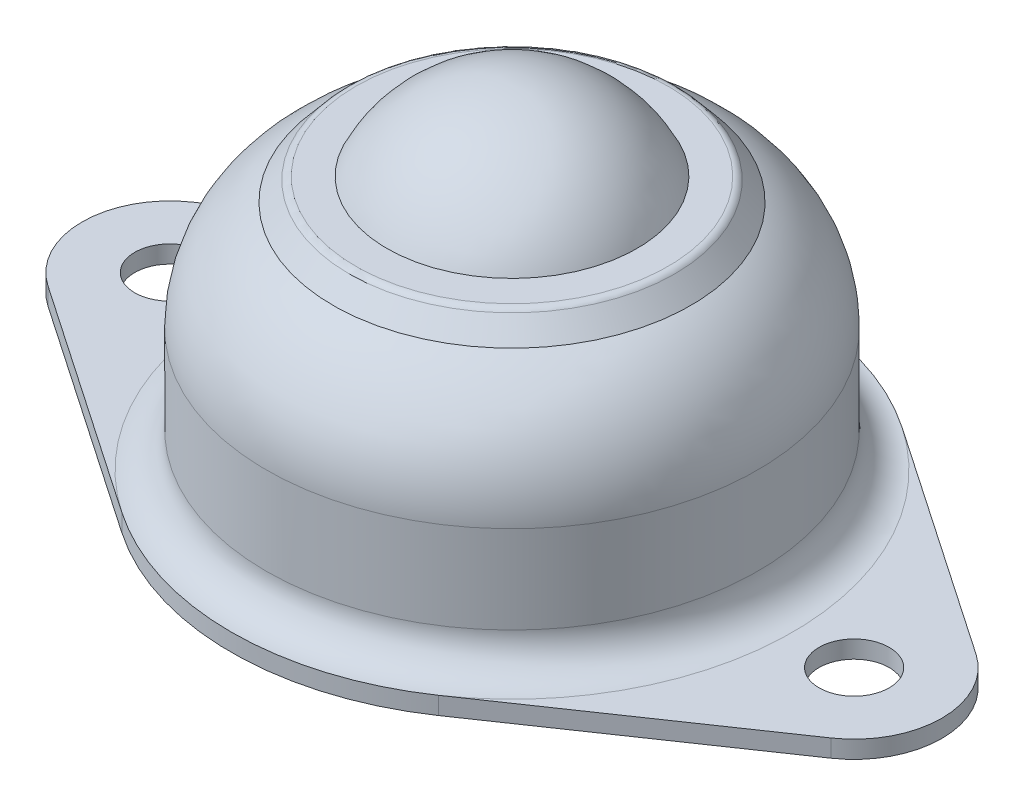
from build123d import *

# Parameters (mm, degrees)
SKETCH_1_R      = 2
EXTRUDE_1_DEPTH = 1
FILLET_1_R      = 2
FILLET_3_R      = 2


with BuildPart() as part:
    # 草圖1 → 填料-伸長1 (new body)
    with BuildSketch(Plane(origin=(0, 0, 0), x_dir=(1, 0, 0), z_dir=(0, 1, 0))):
        with BuildLine():
            Line((-22.320512821, 4.128523638), (-9.025641026, 13.211275642))
            ThreePointArc((-9.025641026, 13.211275642), (0, 16), (9.025641026, 13.211275642))
            Line((9.025641026, 13.211275642), (22.320512821, 4.128523638))
            ThreePointArc((22.320512821, 4.128523638), (24.5, 0), (22.320512821, -4.128523638))
            Line((22.320512821, -4.128523638), (9.025641026, -13.211275642))
            ThreePointArc((9.025641026, -13.211275642), (0, -16), (-9.025641026, -13.211275642))
            Line((-9.025641026, -13.211275642), (-22.320512821, -4.128523638))
            ThreePointArc((-22.320512821, -4.128523638), (-24.5, 0), (-22.320512821, 4.128523638))
        make_face()
        with Locations(Location((19.5, 0, 0), (0, 0, 270))):
            Circle(SKETCH_1_R, mode=Mode.SUBTRACT)
        with Locations(Location((-19.5, 0, 0), (0, 0, 270))):
            Circle(SKETCH_1_R, mode=Mode.SUBTRACT)
    extrude(amount=EXTRUDE_1_DEPTH)

    # 草圖2 → 旋轉1 (revolve)
    with BuildSketch(Plane.XY):
        with BuildLine():
            Line((-14, 1), (-14, 8))
            ThreePointArc((-14, 8), (-12.975019189, 11.646799376), (-10.200244089, 14.2256275))
            Line((-10.200244089, 14.2256275), (-9.280786987, 15.321393805))
            ThreePointArc((-9.280786987, 15.321393805), (-9.109073896, 15.453153894), (-8.897764765, 15.5))
            Line((-8.897764765, 15.5), (-7.130918594, 15.5))
            ThreePointArc((-7.130918594, 15.5), (-4.216040797, 18.780943047), (0, 20))
            Line((0, 20), (0, 1))
            Line((0, 1), (-14, 1))
        make_face()
    revolve(axis=Axis((0, 20, 0), (0, -1, 0)))

    # 圓角1
    fillet_1_edges = [part.edges().sort_by_distance(p)[0] for p in [
        (14, 1, 0),
    ]]
    fillet(fillet_1_edges, radius=FILLET_1_R - 0.0001)  # a hair under: the kernel refuses the full size

    # 草圖3 → 除料-旋轉1 (revolve, cut)
    with BuildSketch(Plane.XY):
        with BuildLine():
            Line((0, 0), (-13, 0))
            Line((-13, 0), (-13, 7))
            Line((-13, 7), (-12.7, 7))
            add(Edge.make_bspline(
                [(-12.7, 7), (-8.598662897, 1), (0, 1)],
                knots=[0, 0, 0, 1, 1, 1], degree=2))
            Line((0, 1), (0, 0))
        make_face()
    revolve(axis=Axis((0, 1, 0), (0, -1, 0)), mode=Mode.SUBTRACT)

    # 圓角3
    fillet_3_edges = [part.edges().sort_by_distance(p)[0] for p in [
        (13, 0, 0),
    ]]
    fillet(fillet_3_edges, radius=FILLET_3_R)


solid = part.part
